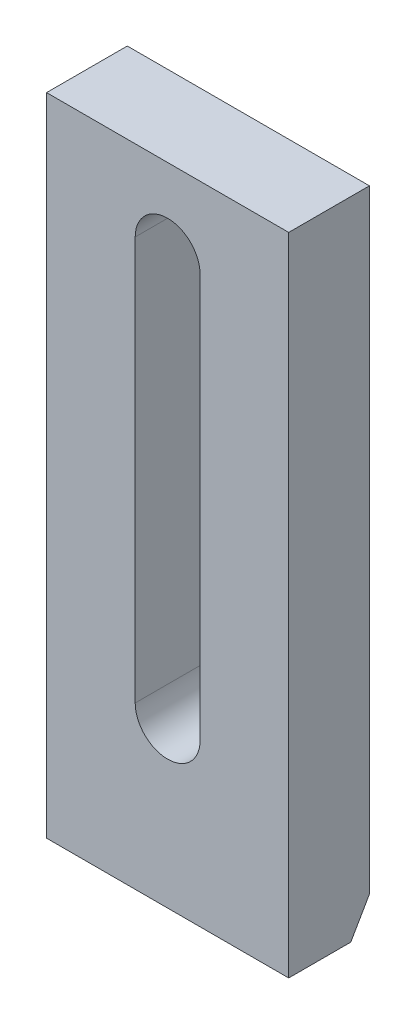
from build123d import *

# Parameters (mm, degrees)
SKETCH_1_W          = 75
SKETCH_1_H          = 200
EXTRUDE_1_DEPTH     = 25
CUT_EXTRUDE_1_DEPTH = 216.058131676
CHAMFER_1_SIZE      = 10
CHAMFER_1_SIZE2     = 5.773502692


with BuildPart() as part:
    # Эскиз1 → Бобышка-Вытянуть1 (new body)
    with BuildSketch(Plane.XY):
        with Locations((37.5, 100)):
            Rectangle(SKETCH_1_W, SKETCH_1_H)
    extrude(amount=EXTRUDE_1_DEPTH)

    # Эскиз2 → Вырез-Вытянуть1 (cut, through all)
    with BuildSketch(Plane.XY.offset(25)):
        with BuildLine():
            Line((27.45, 50), (27.45, 175))
            ThreePointArc((27.45, 175), (37.5, 185.05), (47.55, 175))
            Line((47.55, 175), (47.55, 50))
            ThreePointArc((47.55, 50), (37.5, 39.95), (27.45, 50))
        make_face()
    extrude(amount=-CUT_EXTRUDE_1_DEPTH, mode=Mode.SUBTRACT)

    # Фаска1
    chamfer_1_edges = [part.edges().sort_by_distance(p)[0] for p in [
        (37.5, 0, 0),
    ]]
    chamfer_1_side = [part.faces().sort_by_distance(p)[0] for p in [
        (37.5, 2.136000936, 0),
    ]]
    chamfer(chamfer_1_edges, length=CHAMFER_1_SIZE, length2=CHAMFER_1_SIZE2, reference=chamfer_1_side[0])


solid = part.part
